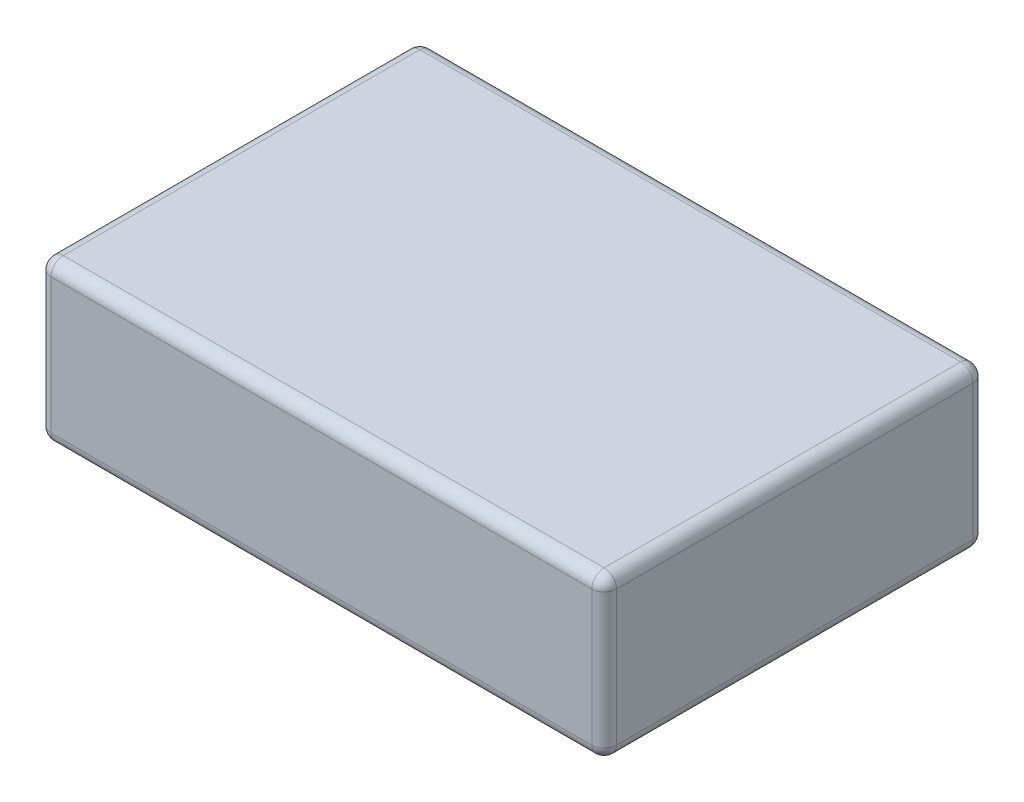
from build123d import *

# Parameters (mm, degrees)
ESBO_O1_W                = 92
ESBO_O1_H                = 62
RESSALTO_EXTRUS_O1_DEPTH = 26
FILETE1_R                = 2
CASCA2_START             = -44
CASCA2_OUTLINE_W         = 22
CASCA2_OUTLINE_H         = 58
CASCA2_DEPTH             = 88


# Read off the part's stored shape, not the designer's step: Casca2
with BuildPart() as part:
    # Esboço1 → Ressalto-extrusão1 (new body)
    with BuildSketch(Plane(origin=(0, 0, 0), x_dir=(1, 0, 0), z_dir=(0, 1, 0))):
        Rectangle(ESBO_O1_W, ESBO_O1_H)
    extrude(amount=RESSALTO_EXTRUS_O1_DEPTH)

    # Filete1
    filete1_edges = [part.edges().sort_by_distance(p)[0] for p in [
        (-46, 26, 0),
        (0, 26, 31),
        (46, 26, 0),
        (0, 0, 31),
        (-46, 0, 0),
        (0, 0, -31),
        (46, 0, 0),
        (0, 26, -31),
        (46, 13, 31),
        (-46, 13, 31),
        (-46, 13, -31),
        (46, 13, -31),
    ]]
    fillet(filete1_edges, radius=FILETE1_R)

    # Casca2 outline → Casca2 (cut)
    with BuildSketch(Plane.YZ.offset(CASCA2_START)):
        with Locations((13, 0)):
            Rectangle(CASCA2_OUTLINE_W, CASCA2_OUTLINE_H)
    extrude(amount=CASCA2_DEPTH, mode=Mode.SUBTRACT)


solid = part.part
